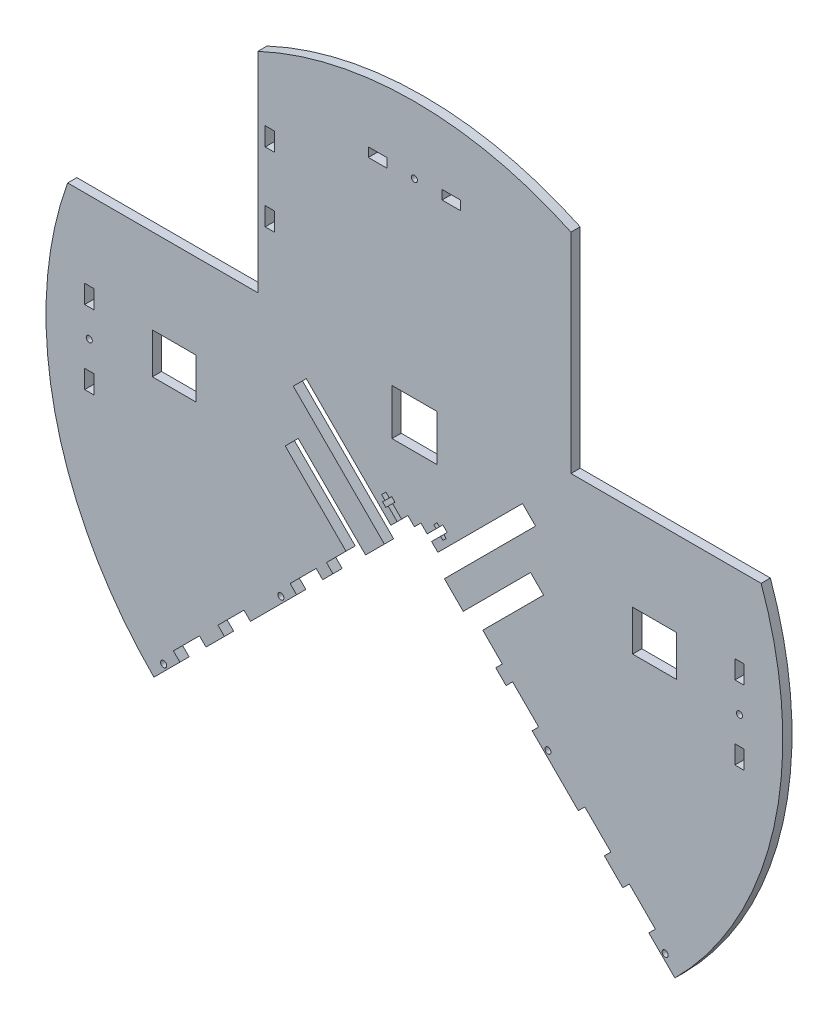
from build123d import *

# Parameters (mm, degrees)
SKETCH1_R           = 254
BOSS_EXTRUDE1_DEPTH = 6.35
CUT_EXTRUDE1_DEPTH  = 530.881249762
CUT_EXTRUDE2_DEPTH  = 466.964215177
SKETCH6_R           = 2.0955
CUT_EXTRUDE4_DEPTH  = 466.964215177
SKETCH7_R           = 2.0955
CUT_EXTRUDE5_DEPTH  = 466.964215177
CUT_EXTRUDE6_DEPTH  = 466.964215177
CUT_EXTRUDE7_DEPTH  = 466.964215177
CUT_EXTRUDE8_DEPTH  = 466.964215177
SKETCH11_W          = 6.35
SKETCH11_H          = 12.7
SKETCH11_W_2        = 12.7
SKETCH11_H_2        = 6.35
CUT_EXTRUDE9_DEPTH  = 466.964215177
SKETCH12_W          = 138.354833831
SKETCH12_H          = 159.746045219
CUT_EXTRUDE10_DEPTH = 466.964215177
SKETCH13_W          = 30.235101182
SKETCH13_H          = 28.022776705
SKETCH13_W_2        = 30.972542674
SKETCH13_H_2        = 31.709984167
CUT_EXTRUDE11_DEPTH = 466.964215177
SKETCH15_W          = 6.35
SKETCH15_H          = 12.7
CUT_EXTRUDE12_DEPTH = 466.964215177


with BuildPart() as part:
    # Sketch1 → Boss-Extrude1 (new body)
    with BuildSketch(Plane.XY):
        with Locations((0, -210.99227558)):
            Circle(SKETCH1_R)
    extrude(amount=BOSS_EXTRUDE1_DEPTH)

    # Sketch3 → Cut-Extrude1 (cut, through all)
    with BuildSketch(Plane(origin=(0, 0, 0), x_dir=(-1, 0, 0), z_dir=(0, 0, -1))):
        with BuildLine():
            Line((179.605122421, -390.597398001), (0, -210.99227558))
            Line((0, -210.99227558), (-179.605122421, -390.597398001))
            ThreePointArc((-179.605122421, -390.597398001), (0, -464.99227558), (179.605122421, -390.597398001))
        make_face()
    extrude(amount=-CUT_EXTRUDE1_DEPTH, mode=Mode.SUBTRACT)

    # Sketch4 → Cut-Extrude2 (cut, through all)
    with BuildSketch(Plane.XY.offset(6.35)):
        Polygon((-161.644610179, -372.636885759), (-166.13473824, -368.146757699), (-148.174225998, -350.186245456), (-143.684097937, -354.676373517), align=None)
        Polygon((-130.96805527, -341.960330849), (-135.45818333, -337.470202789), (-117.497671088, -319.509690547), (-113.007543028, -323.999818607), align=None)
        Polygon((-81.190495591, -292.18277117), (-85.680623651, -287.69264311), (-67.720111409, -269.732130868), (-63.229983348, -274.222258928), align=None)
        Polygon((-56.126600757, -267.118876336), (-60.616728817, -262.628748276), (-38.166088515, -240.178107973), (-33.675960454, -244.668236034), align=None)
        Polygon((-11.689323621, -222.681599201), (-16.179451682, -218.19147114), (-4.490128061, -206.502147519), (0, -210.99227558), align=None)
    cut_extrude2 = extrude(amount=-CUT_EXTRUDE2_DEPTH, mode=Mode.SUBTRACT)

    # Mirror1: Cut-Extrude2 across plane
    add(cut_extrude2.mirror(Plane(origin=(0, 0, 0), x_dir=(0, 0, 1), z_dir=(1, 0, 0))), mode=Mode.SUBTRACT)

    # Sketch6 → Cut-Extrude4 (cut, through all)
    with BuildSketch(Plane.XY.offset(6.35)):
        with Locations((-172.869930331, -379.37207785)):
            Circle(SKETCH6_R)
        with Locations((-92.047625241, -298.54977276)):
            Circle(SKETCH6_R)
    cut_extrude4 = extrude(amount=-CUT_EXTRUDE4_DEPTH, mode=Mode.SUBTRACT)

    # Mirror2: Cut-Extrude4 across plane
    add(cut_extrude4.mirror(Plane(origin=(0, 0, 0), x_dir=(0, 0, 1), z_dir=(1, 0, 0))), mode=Mode.SUBTRACT)

    # Sketch7 → Cut-Extrude5 (cut, through all)
    with BuildSketch(Plane.XY.offset(6.35)):
        with Locations((-224.155, -210.99227558)):
            Circle(SKETCH7_R)
        with Locations((-157.039383505, -67.193079029)):
            Circle(SKETCH7_R)
        with Locations((0, -3.175)):
            Circle(SKETCH7_R)
        with Locations((157.039383505, -67.193079029)):
            Circle(SKETCH7_R)
        with Locations((224.155, -210.99227558)):
            Circle(SKETCH7_R)
    extrude(amount=-CUT_EXTRUDE5_DEPTH, mode=Mode.SUBTRACT)

    # Sketch8 → Cut-Extrude6 (cut, through all)
    with BuildSketch(Plane.XY.offset(6.35)):
        Polygon((-20.669579742, -231.661855322), (-11.689323621, -222.681599201), (-74.551116468, -159.819806353), (-83.53137259, -168.800062475), align=None)
    cut_extrude6 = extrude(amount=-CUT_EXTRUDE6_DEPTH, mode=Mode.SUBTRACT)

    # Mirror3: Cut-Extrude6 across plane
    add(cut_extrude6.mirror(Plane(origin=(0, 0, 0), x_dir=(0, 0, 1), z_dir=(1, 0, 0))), mode=Mode.SUBTRACT)

    # Sketch9 → Cut-Extrude7 (cut, through all)
    with BuildSketch(Plane.XY.offset(6.35)):
        Polygon((-11.843472899, -213.855492358), (-8.826106843, -210.838126301), (-15.022483566, -204.641749578), (-13.388076952, -203.007342964), (-15.633140982, -200.762278934), (-17.267547597, -202.396685548), (-19.602414188, -200.061818956), (-22.619780245, -203.079185013), (-20.284913653, -205.414051604), (-21.919320267, -207.048458218), (-19.674256237, -209.293522249), (-18.039849623, -207.659115635), align=None)
    cut_extrude7 = extrude(amount=-CUT_EXTRUDE7_DEPTH, mode=Mode.SUBTRACT)

    # Mirror4: Cut-Extrude7 across plane
    add(cut_extrude7.mirror(Plane(origin=(0, 0, 0), x_dir=(0, 0, 1), z_dir=(1, 0, 0))), mode=Mode.SUBTRACT)

    # Sketch10 → Cut-Extrude8 (cut, through all)
    with BuildSketch(Plane.XY.offset(6.35)):
        Polygon((-80.08071282, -198.263483667), (-89.060968941, -207.243739789), (-42.656216575, -253.648492155), (-33.675960454, -244.668236034), align=None)
    cut_extrude8 = extrude(amount=-CUT_EXTRUDE8_DEPTH, mode=Mode.SUBTRACT)

    # Mirror5: Cut-Extrude8 across plane
    add(cut_extrude8.mirror(Plane(origin=(0, 0, 0), x_dir=(0, 0, 1), z_dir=(1, 0, 0))), mode=Mode.SUBTRACT)

    # Sketch11 → Cut-Extrude9 (cut, through all)
    with BuildSketch(Plane.XY.offset(6.35)):
        with Locations((224.155, -185.59227558)):
            Rectangle(SKETCH11_W, SKETCH11_H)
        with Locations((224.155, -236.39227558)):
            Rectangle(SKETCH11_W, SKETCH11_H)
        with Locations((-224.155, -185.59227558)):
            Rectangle(SKETCH11_W, SKETCH11_H)
        with Locations((-224.155, -236.39227558)):
            Rectangle(SKETCH11_W, SKETCH11_H)
        with Locations((-25.4, -3.175)):
            Rectangle(SKETCH11_W_2, SKETCH11_H_2)
        with Locations((25.4, -3.175)):
            Rectangle(SKETCH11_W_2, SKETCH11_H_2)
    extrude(amount=-CUT_EXTRUDE9_DEPTH, mode=Mode.SUBTRACT)

    # Sketch12 → Cut-Extrude10 (cut, through all)
    with BuildSketch(Plane(origin=(0, 0, 0), x_dir=(-1, 0, 0), z_dir=(0, 0, -1))):
        with Locations((177.128041496, -45.34063784)):
            Rectangle(SKETCH12_W, SKETCH12_H)
        with Locations((-177.128041496, -45.34063784)):
            Rectangle(SKETCH12_W, SKETCH12_H)
    extrude(amount=-CUT_EXTRUDE10_DEPTH, mode=Mode.SUBTRACT)

    # Sketch13 → Cut-Extrude11 (cut, through all)
    with BuildSketch(Plane.XY.offset(6.35)):
        with Locations((-165.55561501, -197.761685289)):
            Rectangle(SKETCH13_W, SKETCH13_H)
        with Locations((0, -150.196709038)):
            Rectangle(SKETCH13_W_2, SKETCH13_H_2)
        with Locations((165.55561501, -197.761685289)):
            Rectangle(SKETCH13_W, SKETCH13_H)
    extrude(amount=-CUT_EXTRUDE11_DEPTH, mode=Mode.SUBTRACT)

    # Sketch15 → Cut-Extrude12 (cut, through all)
    with BuildSketch(Plane.XY.offset(6.35)):
        with Locations((-99.697228301, -77.000099019)):
            Rectangle(SKETCH15_W, SKETCH15_H)
        with Locations((-99.697228301, -29.287019483)):
            Rectangle(SKETCH15_W, SKETCH15_H)
    extrude(amount=-CUT_EXTRUDE12_DEPTH, mode=Mode.SUBTRACT)


solid = part.part
